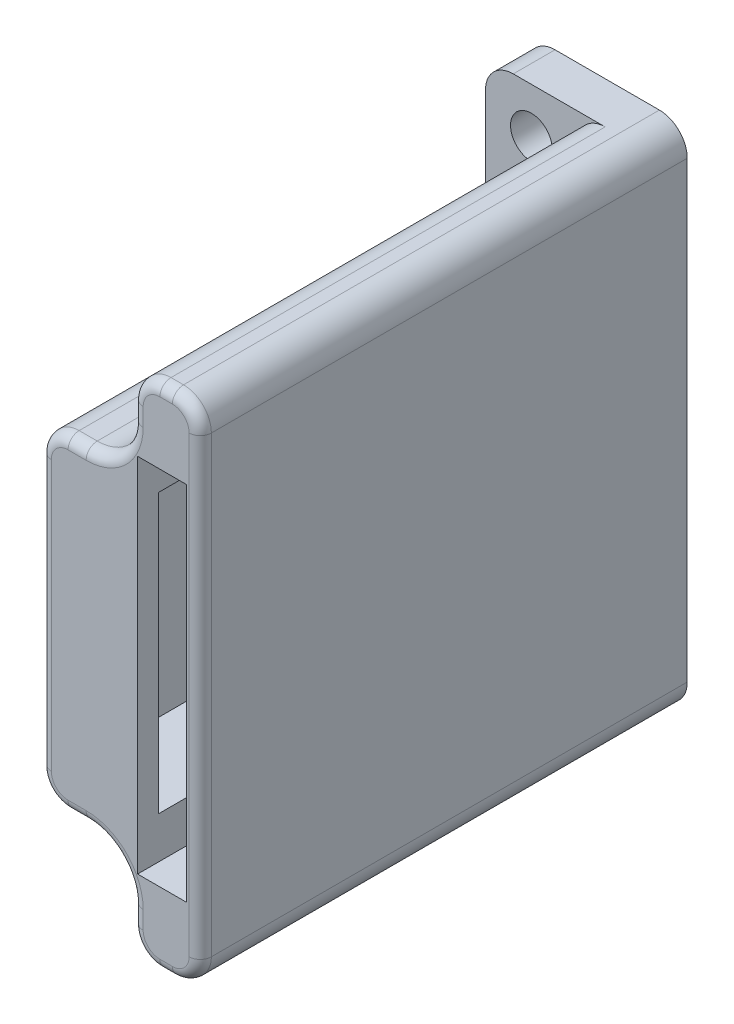
from build123d import *

# Parameters (mm, degrees)
SKETCH1_W           = 14.605
SKETCH1_H           = 46.482
SKETCH1_R           = 1.905
BOSS_EXTRUDE1_DEPTH = 44.45
SKETCH2_W           = 4.445
SKETCH2_H           = 33.02
CUT_EXTRUDE1_DEPTH  = 38.1
SKETCH3_W           = 42.545
SKETCH3_H           = 25.4
CUT_EXTRUDE2_DEPTH  = 12.065
CUT_EXTRUDE3_DEPTH  = 40.64
FILLET1_R           = 2.54
FILLET2_R           = 1.016
CHAMFER1_SIZE       = 7.62


with BuildPart() as part:
    # Sketch1 → Boss-Extrude1 (new body)
    with BuildSketch(Plane.XY):
        with Locations((7.3025, 23.241)):
            Rectangle(SKETCH1_W, SKETCH1_H)
        with Locations((4.191, 42.291)):
            Circle(SKETCH1_R, mode=Mode.SUBTRACT)
        with Locations((4.191, 4.191)):
            Circle(SKETCH1_R, mode=Mode.SUBTRACT)
    extrude(amount=BOSS_EXTRUDE1_DEPTH)

    # Sketch2 → Cut-Extrude1 (cut)
    with BuildSketch(Plane.XY.offset(44.45)):
        with Locations((11.1125, 23.241)):
            Rectangle(SKETCH2_W, SKETCH2_H)
    extrude(amount=-CUT_EXTRUDE1_DEPTH, mode=Mode.SUBTRACT)

    # Sketch3 → Cut-Extrude2 (cut)
    with BuildSketch(Plane.ZY.offset(-13.335)):
        with Locations((21.2725, 23.241)):
            Rectangle(SKETCH3_W, SKETCH3_H)
    extrude(amount=CUT_EXTRUDE2_DEPTH, mode=Mode.SUBTRACT)

    # Sketch4 → Cut-Extrude3 (cut)
    with BuildSketch(Plane.XY.offset(44.45)):
        with BuildLine():
            Line((4.191, 38.1), (0, 38.1))
            Line((0, 38.1), (0, 46.482))
            Line((0, 46.482), (8.382, 46.482))
            Line((8.382, 46.482), (8.382, 42.291))
            ThreePointArc((8.382, 42.291), (7.15448452, 39.32751548), (4.191, 38.1))
        make_face()
        with BuildLine():
            Line((4.191, 8.382), (0, 8.382))
            Line((0, 8.382), (0, 0))
            Line((0, 0), (8.382, 0))
            Line((8.382, 0), (8.382, 4.191))
            ThreePointArc((8.382, 4.191), (7.15448452, 7.15448452), (4.191, 8.382))
        make_face()
    extrude(amount=-CUT_EXTRUDE3_DEPTH, mode=Mode.SUBTRACT)

    # Fillet1
    fillet1_edges = [part.edges().sort_by_distance(p)[0] for p in [
        (0, 46.482, 1.905),
        (8.382, 46.482, 24.13),
        (0, 38.1, 24.13),
        (14.605, 46.482, 22.225),
        (0, 0, 1.905),
        (14.605, 0, 22.225),
        (8.382, 0, 24.13),
        (0, 8.382, 24.13),
    ]]
    fillet(fillet1_edges, radius=FILLET1_R)

    # Fillet2
    fillet2_edges = [part.edges().sort_by_distance(p)[0] for p in [
        (3.3655, 38.1, 44.45),
        (0, 23.241, 44.45),
        (13.861051224, 45.738051224, 44.45),
        (13.861051224, 0.743948776, 44.45),
        (9.125948776, 0.743948776, 44.45),
        (0.743948776, 9.125948776, 44.45),
        (0.743948776, 37.356051224, 44.45),
        (9.125948776, 45.738051224, 44.45),
        (7.15448452, 39.32751548, 44.45),
        (8.382, 43.1165, 44.45),
        (7.15448452, 7.15448452, 44.45),
        (3.3655, 8.382, 44.45),
        (11.4935, 46.482, 44.45),
        (8.382, 3.3655, 44.45),
        (11.4935, 0, 44.45),
        (14.605, 23.241, 44.45),
    ]]
    fillet(fillet2_edges, radius=FILLET2_R)

    # Chamfer1
    chamfer1_edges = [part.edges().sort_by_distance(p)[0] for p in [
        (1.27, 23.241, 42.545),
    ]]
    chamfer(chamfer1_edges, length=CHAMFER1_SIZE - 0.0001)  # a hair under: the kernel refuses the full size


solid = part.part
